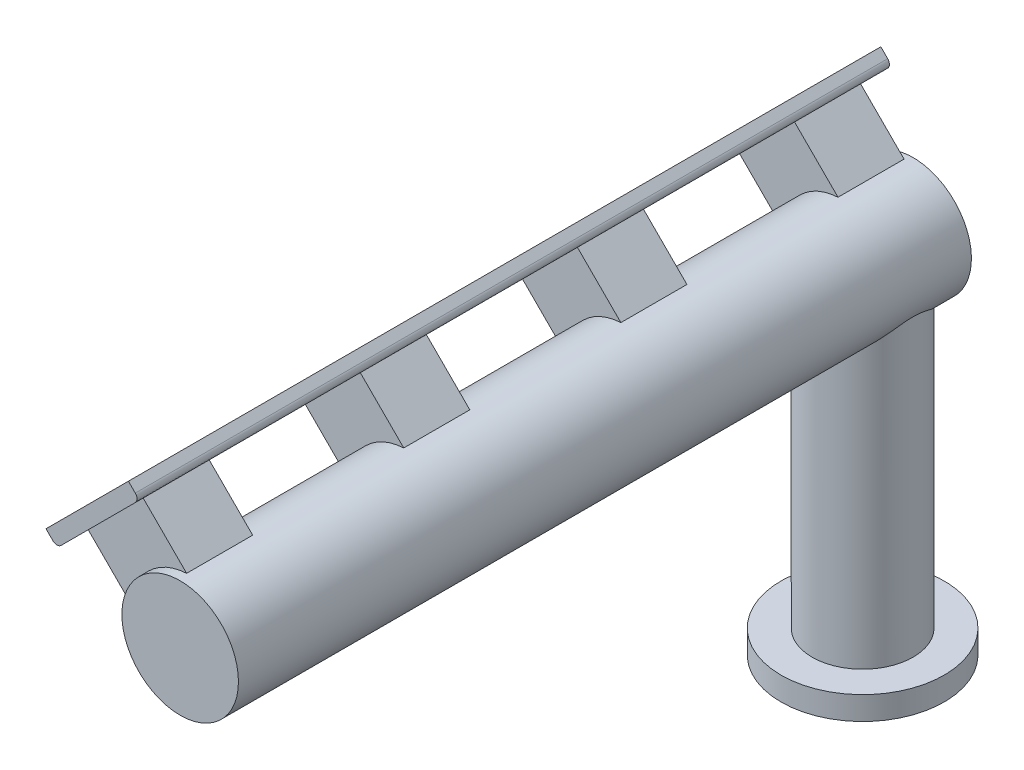
from build123d import *

# Parameters (mm, degrees)
HEAD_START          = -349.38
HEAD_FLANGE_DEPTH   = 387.28
PRIMARY_START       = -5.1
PRIMARY_1_DEPTH     = 34
PRIMARY_START_2     = -116.86
PRIMARY_3_DEPTH     = 34
PRIMARY_START_3     = -228.62
PRIMARY_5_DEPTH     = 34
PRIMARY_START_4     = -340.38
PRIMARY_7_DEPTH     = 34
COLLECTOR_START     = -343.38
SKETCH6_R           = 30
COLLECTOR_DEPTH     = 377.28
OUTLET_START        = -60
SKETCH7_R           = 26
OUTLET_PIPE_DEPTH   = 166.73776862
OUTLET_START_2      = -72
SKETCH8_R           = 42
OUTLET_FLANGE_DEPTH = 12
OUTLET_START_3      = -73
SKETCH9_R           = 20
OUTLET_BORE_DEPTH   = 169.73776862


with BuildPart() as part:
    # Sketch1 → Head Flange (new body)
    with BuildSketch(Plane.XY.offset(HEAD_START)):
        with BuildLine():
            Line((231.188562109, 129.365185618), (234.724096015, 125.829651712))
            ThreePointArc((234.724096015, 125.829651712), (236.845416358, 124.950972056), (238.966736702, 125.829651712))
            Line((238.966736702, 125.829651712), (277.150502886, 164.013417896))
            ThreePointArc((277.150502886, 164.013417896), (278.029182543, 166.13473824), (277.150502886, 168.256058583))
            Line((277.150502886, 168.256058583), (273.61496898, 171.791592489))
            Line((273.61496898, 171.791592489), (231.188562109, 129.365185618))
        make_face()
    extrude(amount=HEAD_FLANGE_DEPTH)

    # Sketch2 → Primary 1 (add)
    with BuildSketch(Plane.XY.offset(PRIMARY_START)):
        Polygon((266.543901168, 164.720524677), (310.384521602, 120.879904244), (282.100250354, 92.595632996), (238.259629921, 136.43625343), align=None)
    extrude(amount=PRIMARY_1_DEPTH)

    # Sketch3 → Primary 3 (add)
    with BuildSketch(Plane.XY.offset(PRIMARY_START_2)):
        Polygon((266.543901168, 164.720524677), (310.384521602, 120.879904244), (282.100250354, 92.595632996), (238.259629921, 136.43625343), align=None)
    extrude(amount=PRIMARY_3_DEPTH)

    # Sketch4 → Primary 5 (add)
    with BuildSketch(Plane.XY.offset(PRIMARY_START_3)):
        Polygon((266.543901168, 164.720524677), (310.384521602, 120.879904244), (282.100250354, 92.595632996), (238.259629921, 136.43625343), align=None)
    extrude(amount=PRIMARY_5_DEPTH)

    # Sketch5 → Primary 7 (add)
    with BuildSketch(Plane.XY.offset(PRIMARY_START_4)):
        Polygon((266.543901168, 164.720524677), (310.384521602, 120.879904244), (282.100250354, 92.595632996), (238.259629921, 136.43625343), align=None)
    extrude(amount=PRIMARY_7_DEPTH)

    # Sketch6 → Collector (add)
    with BuildSketch(Plane.XY.offset(COLLECTOR_START)):
        with Locations((296.242385978, 106.73776862)):
            Circle(SKETCH6_R)
    extrude(amount=COLLECTOR_DEPTH)

    # Sketch7 → Outlet Pipe (add)
    with BuildSketch(Plane(origin=(0, 0, 0), x_dir=(1, 0, 0), z_dir=(0, 1, 0)).offset(OUTLET_START)):
        with Locations((296.242385978, 317.38)):
            Circle(SKETCH7_R)
    extrude(amount=OUTLET_PIPE_DEPTH)

    # Sketch8 → Outlet Flange (add)
    with BuildSketch(Plane(origin=(0, 0, 0), x_dir=(1, 0, 0), z_dir=(0, 1, 0)).offset(OUTLET_START_2)):
        with Locations((296.242385978, 317.38)):
            Circle(SKETCH8_R)
    extrude(amount=OUTLET_FLANGE_DEPTH)

    # Sketch9 → Outlet Bore (cut)
    with BuildSketch(Plane(origin=(0, 0, 0), x_dir=(1, 0, 0), z_dir=(0, 1, 0)).offset(OUTLET_START_3)):
        with Locations((296.242385978, 317.38)):
            Circle(SKETCH9_R)
    extrude(amount=OUTLET_BORE_DEPTH, mode=Mode.SUBTRACT)


solid = part.part
